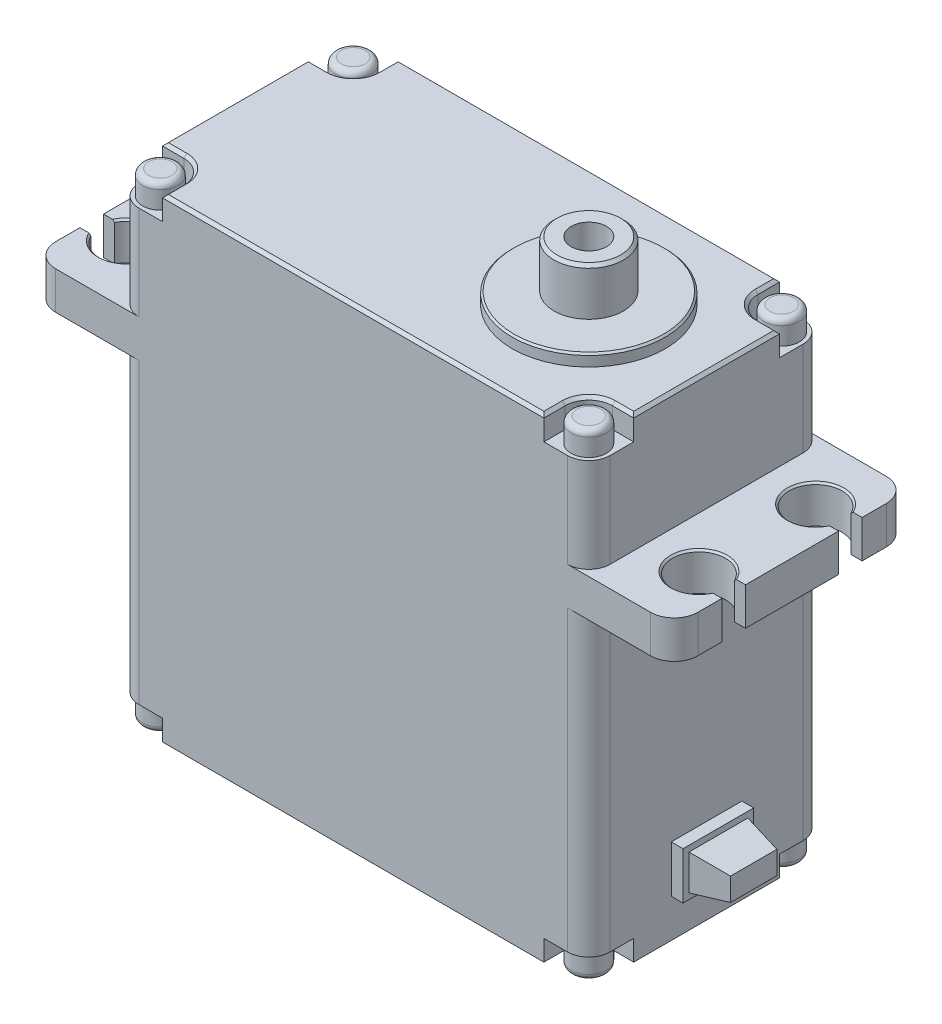
from build123d import *

# Parameters (mm, degrees)
SALIENTE_EXTRUIR1_DEPTH  = 27.3
CORTAR_EXTRUIR1_DEPTH    = 2
CROQUIS3_R               = 1.5
SALIENTE_EXTRUIR2_DEPTH  = 2
REDONDEO1_R              = 0.5
REDONDEO1_OF_SIMETR_A1_R = 0.5
CHAFL_N1_SIZE            = 0.25
CROQUIS4_W               = 6
CROQUIS4_H               = 4
SALIENTE_EXTRUIR3_DEPTH  = 1
CROQUIS5_W               = 5
CROQUIS5_H               = 3
SALIENTE_EXTRUIR4_DEPTH  = 3
SALIENTE_EXTRUIR4_TAPER  = 10
SALIENTE_EXTRUIR5_DEPTH  = 3.2
CORTAR_EXTRUIR2_DEPTH    = 3.2
CHAFL_N2_SIZE            = 0.15
SALIENTE_EXTRUIR6_DEPTH  = 10
CORTAR_EXTRUIR3_START    = -2
CORTAR_EXTRUIR3_DEPTH    = 2
SALIENTE_EXTRUIR7_START  = 2
CROQUIS10_R              = 1.5
SALIENTE_EXTRUIR7_DEPTH  = 2
REDONDEO2_R              = 0.5
REDONDEO2_OF_SIMETR_A3_R = 0.5
CHAFL_N3_SIZE            = 0.25
CROQUIS11_R              = 6.5
SALIENTE_EXTRUIR8_DEPTH  = 1
CHAFL_N4_SIZE            = 0.15
CROQUIS12_R              = 2.95
SALIENTE_EXTRUIR9_DEPTH  = 4
CHAFL_N5_SIZE            = 0.25
CROQUIS13_R              = 1.5
CORTAR_EXTRUIR4_DEPTH    = 4


# Read off the part's stored shape, not the designer's step: Simetría2, Simetría4
with BuildPart() as part:
    # Croquis1 → Saliente-Extruir1 (new body)
    with BuildSketch(Plane(origin=(0, 0, 0), x_dir=(1, 0, 0), z_dir=(0, 1, 0))):
        with BuildLine():
            Line((-18.187919463, -10), (18.187919463, -10))
            ThreePointArc((18.187919463, -10), (19.469253899, -9.469253899), (20, -8.187919463))
            Line((20, -8.187919463), (20, 8.187919463))
            ThreePointArc((20, 8.187919463), (19.469253899, 9.469253899), (18.187919463, 10))
            Line((18.187919463, 10), (-18.187919463, 10))
            ThreePointArc((-18.187919463, 10), (-19.469253899, 9.469253899), (-20, 8.187919463))
            Line((-20, 8.187919463), (-20, -8.187919463))
            ThreePointArc((-20, -8.187919463), (-19.469253899, -9.469253899), (-18.187919463, -10))
        make_face()
    extrude(amount=SALIENTE_EXTRUIR1_DEPTH)

    # Croquis2 → Cortar-Extruir1 (cut)
    with BuildSketch(Plane.XZ):
        with BuildLine():
            Line((-20, 8.187919463), (-20, 6.187919463))
            Line((-20, 6.187919463), (-18.187919463, 6.187919463))
            ThreePointArc((-18.187919463, 6.187919463), (-16.773705901, 6.773705901), (-16.187919463, 8.187919463))
            Line((-16.187919463, 8.187919463), (-16.187919463, 10))
            Line((-16.187919463, 10), (-18.187919463, 10))
            ThreePointArc((-18.187919463, 10), (-19.469253899, 9.469253899), (-20, 8.187919463))
        make_face()
    cortar_extruir1 = extrude(amount=-CORTAR_EXTRUIR1_DEPTH, mode=Mode.SUBTRACT)

    # Croquis3 → Saliente-Extruir2 (add)
    with BuildSketch(Plane.XZ.offset(-2)):
        with Locations(Location((-18.187919463, 8.187919463, 0), (0, 0, 270))):
            Circle(CROQUIS3_R)
    saliente_extruir2 = extrude(amount=SALIENTE_EXTRUIR2_DEPTH)

    # Redondeo1
    redondeo1_edges = [part.edges().sort_by_distance(p)[0] for p in [
        (-18.187919463, 0, 9.687919463),
    ]]
    fillet(redondeo1_edges, radius=REDONDEO1_R)

    # Simetría1: Cortar-Extruir1, Saliente-Extruir2 across plane
    add(cortar_extruir1.mirror(Plane(origin=(0, 0, 0), x_dir=(0, 0, 1), z_dir=(1, 0, 0))), mode=Mode.SUBTRACT)
    add(saliente_extruir2.mirror(Plane(origin=(0, 0, 0), x_dir=(0, 0, 1), z_dir=(1, 0, 0))))

    # Redondeo1 of Simetría1
    redondeo1_of_simetr_a1_edges = [part.edges().sort_by_distance(p)[0] for p in [
        (18.187919463, 0, 9.687919463),
    ]]
    fillet(redondeo1_of_simetr_a1_edges, radius=REDONDEO1_OF_SIMETR_A1_R)

    # Simetría2
    split(bisect_by=Plane.XY, keep=Keep.TOP)

    # Simetr_a2 2: part across plane


with BuildPart() as part_1:
    add(part.part)
    add(part.part.mirror(Plane.XY))

    # Chaflán1
    chafl_n1_edges = [part_1.edges().sort_by_distance(p)[0] for p in [
        (0, 0, -10),
        (19.093959732, 0, -6.187919463),
        (16.773705901, 0, -6.773705901),
        (16.187919463, 0, -9.093959732),
        (0, 0, 10),
        (-19.093959732, 0, 6.187919463),
        (-16.773705901, 0, 6.773705901),
        (-16.187919463, 0, 9.093959732),
        (20, 0, 0),
        (19.093959732, 0, 6.187919463),
        (16.773705901, 0, 6.773705901),
        (16.187919463, 0, 9.093959732),
        (-20, 0, 0),
        (-19.093959732, 0, -6.187919463),
        (-16.773705901, 0, -6.773705901),
        (-16.187919463, 0, -9.093959732),
    ]]
    chamfer(chafl_n1_edges, length=CHAFL_N1_SIZE)

    # Croquis4 → Saliente-Extruir3 (add)
    with BuildSketch(Plane(origin=(20, 0, 0), x_dir=(0, 0, -1), z_dir=(1, 0, 0))):
        with Locations((0, 5.5)):
            Rectangle(CROQUIS4_W, CROQUIS4_H)
    extrude(amount=SALIENTE_EXTRUIR3_DEPTH)

    # Croquis5 → Saliente-Extruir4 (add)
    with BuildSketch(Plane(origin=(21, 0, 0), x_dir=(0, 0, -1), z_dir=(1, 0, 0))):
        with Locations((0, 5.5)):
            Rectangle(CROQUIS5_W, CROQUIS5_H)
    extrude(amount=SALIENTE_EXTRUIR4_DEPTH, taper=SALIENTE_EXTRUIR4_TAPER)

    # Croquis6 → Saliente-Extruir5 (add)
    with BuildSketch(Plane(origin=(0, 27.3, 0), x_dir=(1, 0, 0), z_dir=(0, 1, 0))):
        with BuildLine():
            Line((-25.25, -10), (25.25, -10))
            ThreePointArc((25.25, -10), (26.664213562, -9.414213562), (27.25, -8))
            Line((27.25, -8), (27.25, 8))
            ThreePointArc((27.25, 8), (26.664213562, 9.414213562), (25.25, 10))
            Line((25.25, 10), (-25.25, 10))
            ThreePointArc((-25.25, 10), (-26.664213562, 9.414213562), (-27.25, 8))
            Line((-27.25, 8), (-27.25, -8))
            ThreePointArc((-27.25, -8), (-26.664213562, -9.414213562), (-25.25, -10))
        make_face()
    extrude(amount=SALIENTE_EXTRUIR5_DEPTH)

    # Croquis7 → Cortar-Extruir2 (cut)
    with BuildSketch(Plane(origin=(0, 30.5, 0), x_dir=(1, 0, 0), z_dir=(0, 1, 0))):
        with BuildLine():
            Line((-27.25, 5.95), (-27.25, 3.95))
            Line((-27.25, 3.95), (-26.315564437, 3.95))
            ThreePointArc((-26.315564437, 3.95), (-22.05, 4.95), (-26.315564437, 5.95))
            Line((-26.315564437, 5.95), (-27.25, 5.95))
        make_face()
        with BuildLine():
            Line((27.25, 5.95), (27.25, 3.95))
            Line((27.25, 3.95), (26.315564437, 3.95))
            ThreePointArc((26.315564437, 3.95), (22.05, 4.95), (26.315564437, 5.95))
            Line((26.315564437, 5.95), (27.25, 5.95))
        make_face()
        with BuildLine():
            Line((27.25, -5.95), (26.315564437, -5.95))
            ThreePointArc((26.315564437, -5.95), (22.05, -4.95), (26.315564437, -3.95))
            Line((26.315564437, -3.95), (27.25, -3.95))
            Line((27.25, -3.95), (27.25, -5.95))
        make_face()
        with BuildLine():
            Line((-27.25, -3.95), (-26.315564437, -3.95))
            ThreePointArc((-26.315564437, -3.95), (-22.05, -4.95), (-26.315564437, -5.95))
            Line((-26.315564437, -5.95), (-27.25, -5.95))
            Line((-27.25, -5.95), (-27.25, -3.95))
        make_face()
    extrude(amount=-CORTAR_EXTRUIR2_DEPTH, mode=Mode.SUBTRACT)

    # Chaflán2
    chafl_n2_edges = [part_1.edges().sort_by_distance(p)[0] for p in [
        (-22.05, 30.5, -4.95),
        (22.05, 30.5, 4.95),
        (-22.05, 30.5, 4.95),
        (22.05, 30.5, -4.95),
    ]]
    chamfer(chafl_n2_edges, length=CHAFL_N2_SIZE)

    # Croquis8 → Saliente-Extruir6 (add)
    with BuildSketch(Plane(origin=(0, 30.5, 0), x_dir=(1, 0, 0), z_dir=(0, 1, 0))):
        with BuildLine():
            Line((-18.187919463, -10), (18.187919463, -10))
            ThreePointArc((18.187919463, -10), (19.469253899, -9.469253899), (20, -8.187919463))
            Line((20, -8.187919463), (20, 8.187919463))
            ThreePointArc((20, 8.187919463), (19.469253899, 9.469253899), (18.187919463, 10))
            Line((18.187919463, 10), (-18.187919463, 10))
            ThreePointArc((-18.187919463, 10), (-19.469253899, 9.469253899), (-20, 8.187919463))
            Line((-20, 8.187919463), (-20, -8.187919463))
            ThreePointArc((-20, -8.187919463), (-19.469253899, -9.469253899), (-18.187919463, -10))
        make_face()
    extrude(amount=SALIENTE_EXTRUIR6_DEPTH)

    # Croquis9 → Cortar-Extruir3 (cut)
    with BuildSketch(Plane(origin=(0, 40.5, 0), x_dir=(1, 0, 0), z_dir=(0, 1, 0)).offset(CORTAR_EXTRUIR3_START)):
        with BuildLine():
            Line((-20, -8.187919463), (-20, -6.187919463))
            Line((-20, -6.187919463), (-18.187919463, -6.187919463))
            ThreePointArc((-18.187919463, -6.187919463), (-16.773705901, -6.773705901), (-16.187919463, -8.187919463))
            Line((-16.187919463, -8.187919463), (-16.187919463, -10))
            Line((-16.187919463, -10), (-18.187919463, -10))
            ThreePointArc((-18.187919463, -10), (-19.469253899, -9.469253899), (-20, -8.187919463))
        make_face()
    cortar_extruir3 = extrude(amount=CORTAR_EXTRUIR3_DEPTH, mode=Mode.SUBTRACT)

    # Croquis10 → Saliente-Extruir7 (add)
    with BuildSketch(Plane(origin=(0, 38.5, 0), x_dir=(1, 0, 0), z_dir=(0, 1, 0)).offset(SALIENTE_EXTRUIR7_START)):
        with Locations(Location((-18.187919463, -8.187919463, 0), (0, 0, 90))):
            Circle(CROQUIS10_R)
    saliente_extruir7 = extrude(amount=-SALIENTE_EXTRUIR7_DEPTH)

    # Redondeo2
    redondeo2_edges = [part_1.edges().sort_by_distance(p)[0] for p in [
        (-18.187919463, 40.5, 9.687919463),
    ]]
    fillet(redondeo2_edges, radius=REDONDEO2_R)

    # Simetría3: Cortar-Extruir3, Saliente-Extruir7 across plane
    add(cortar_extruir3.mirror(Plane(origin=(0, 0, 0), x_dir=(0, 0, 1), z_dir=(1, 0, 0))), mode=Mode.SUBTRACT)
    add(saliente_extruir7.mirror(Plane(origin=(0, 0, 0), x_dir=(0, 0, 1), z_dir=(1, 0, 0))))

    # Redondeo2 of Simetría3
    redondeo2_of_simetr_a3_edges = [part_1.edges().sort_by_distance(p)[0] for p in [
        (18.187919463, 40.5, 9.687919463),
    ]]
    fillet(redondeo2_of_simetr_a3_edges, radius=REDONDEO2_OF_SIMETR_A3_R)

    # Simetría4
    split(bisect_by=Plane.XY, keep=Keep.TOP)

    # Simetr_a4 2: part across plane


with BuildPart() as part_2:
    add(part_1.part)
    add(part_1.part.mirror(Plane.XY))

    # Chaflán3
    chafl_n3_edges = [part_2.edges().sort_by_distance(p)[0] for p in [
        (0, 40.5, 10),
        (-16.187919463, 40.5, 9.093959732),
        (-16.773705901, 40.5, 6.773705901),
        (-19.093959732, 40.5, 6.187919463),
        (20, 40.5, 0),
        (16.187919463, 40.5, 9.093959732),
        (16.773705901, 40.5, 6.773705901),
        (19.093959732, 40.5, 6.187919463),
        (0, 40.5, -10),
        (16.187919463, 40.5, -9.093959732),
        (16.773705901, 40.5, -6.773705901),
        (19.093959732, 40.5, -6.187919463),
        (-20, 40.5, 0),
        (-16.187919463, 40.5, -9.093959732),
        (-16.773705901, 40.5, -6.773705901),
        (-19.093959732, 40.5, -6.187919463),
    ]]
    chamfer(chafl_n3_edges, length=CHAFL_N3_SIZE)

    # Croquis11 → Saliente-Extruir8 (add)
    with BuildSketch(Plane(origin=(0, 40.5, 0), x_dir=(1, 0, 0), z_dir=(0, 1, 0))):
        with Locations(Location((10, 0, 0), (0, 0, 270))):
            Circle(CROQUIS11_R)
    extrude(amount=SALIENTE_EXTRUIR8_DEPTH)

    # Chaflán4
    chafl_n4_edges = [part_2.edges().sort_by_distance(p)[0] for p in [
        (10, 41.5, -6.5),
    ]]
    chamfer(chafl_n4_edges, length=CHAFL_N4_SIZE)

    # Croquis12 → Saliente-Extruir9 (add)
    with BuildSketch(Plane(origin=(0, 41.5, 0), x_dir=(1, 0, 0), z_dir=(0, 1, 0))):
        with Locations(Location((10, 0, 0), (0, 0, 270))):
            Circle(CROQUIS12_R)
    extrude(amount=SALIENTE_EXTRUIR9_DEPTH)

    # Chaflán5
    chafl_n5_edges = [part_2.edges().sort_by_distance(p)[0] for p in [
        (10, 45.5, -2.95),
    ]]
    chamfer(chafl_n5_edges, length=CHAFL_N5_SIZE)

    # Croquis13 → Cortar-Extruir4 (cut)
    with BuildSketch(Plane(origin=(0, 45.5, 0), x_dir=(1, 0, 0), z_dir=(0, 1, 0))):
        with Locations(Location((10, 0, 0), (0, 0, 270))):
            Circle(CROQUIS13_R)
    extrude(amount=-CORTAR_EXTRUIR4_DEPTH, mode=Mode.SUBTRACT)


solid = part_2.part
